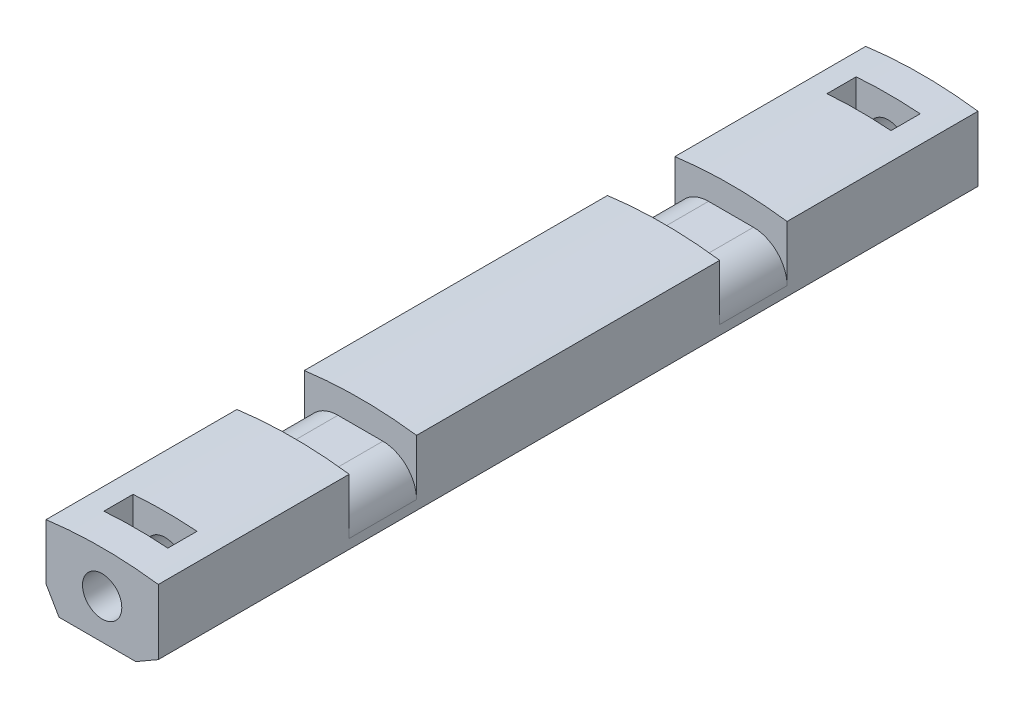
from build123d import *

# Parameters (mm, degrees)
BOSS_EXTRU_2_DEPTH      = 73
ESQUISSE6_W             = 6
ESQUISSE6_H             = 5
ENL_V_MAT_EXTRU_3_DEPTH = 83.675570757
ESQUISSE7_R             = 1.75
ENL_V_MAT_EXTRU_4_DEPTH = 12
ENL_V_START             = -12
ESQUISSE8_R             = 1.75
ENL_V_MAT_EXTRU_5_DEPTH = 12
CONG_1_R                = 3
ENL_V_START_2           = -3
ENL_V_MAT_EXTRU_6_DEPTH = 2.6
ENL_V_START_3           = -5.6
ENL_V_MAT_EXTRU_7_DEPTH = 2.6
CHANFREIN1_SIZE         = 1.154700538
CHANFREIN1_SIZE_2       = 2


with BuildPart() as part:
    # Esquisse3 → Boss.-Extru.2 (new body)
    with BuildSketch(Plane.XY):
        with BuildLine():
            ThreePointArc((-5, 37.165171868), (0, 37.5), (5, 37.165171868))
            Line((5, 37.165171868), (5, 30.214079913))
            Line((5, 30.214079913), (-5, 30.214079913))
            Line((-5, 30.214079913), (-5, 37.165171868))
        make_face()
    extrude(amount=BOSS_EXTRU_2_DEPTH)

    # Esquisse6 → Enlèv. mat.-Extru.3 (cut, through all)
    with BuildSketch(Plane.ZY.offset(5)):
        with Locations((20, 37.714079913)):
            Rectangle(ESQUISSE6_W, ESQUISSE6_H)
        with Locations((53, 37.714079913)):
            Rectangle(ESQUISSE6_W, ESQUISSE6_H)
    extrude(amount=-ENL_V_MAT_EXTRU_3_DEPTH, mode=Mode.SUBTRACT)

    # Esquisse7 → Enlèv. mat.-Extru.4 (cut)
    with BuildSketch(Plane.XY.offset(73)):
        with Locations((0, 33.75)):
            Circle(ESQUISSE7_R)
    extrude(amount=-ENL_V_MAT_EXTRU_4_DEPTH, mode=Mode.SUBTRACT)

    # Esquisse8 → Enlèv. mat.-Extru.5 (cut)
    with BuildSketch(Plane(origin=(0, 0, 0), x_dir=(-1, 0, 0), z_dir=(0, 0, -1)).offset(ENL_V_START)):
        with Locations(Location((0, 33.75, 0), (0, 0, 180))):
            Circle(ESQUISSE8_R)
    extrude(amount=ENL_V_MAT_EXTRU_5_DEPTH, mode=Mode.SUBTRACT)

    # Congé1
    cong_1_edges = [part.edges().sort_by_distance(p)[0] for p in [
        (5, 35.214079913, 20),
        (-5, 35.214079913, 20),
        (5, 35.214079913, 53),
        (-5, 35.214079913, 53),
    ]]
    fillet(cong_1_edges, radius=CONG_1_R)

    # Esquisse9 → Enlèv. mat.-Extru.6 (cut)
    with BuildSketch(Plane(origin=(0, 0, 0), x_dir=(-1, 0, 0), z_dir=(0, 0, -1)).offset(ENL_V_START_2)):
        with BuildLine():
            Line((-2.85, 37.391543162), (-2.85, 31.995448267))
            Line((-2.85, 31.995448267), (0, 30.35))
            Line((0, 30.35), (2.85, 31.995448267))
            Line((2.85, 31.995448267), (2.85, 37.391543162))
            ThreePointArc((2.85, 37.391543162), (0, 37.5), (-2.85, 37.391543162))
        make_face()
    extrude(amount=-ENL_V_MAT_EXTRU_6_DEPTH, mode=Mode.SUBTRACT)

    # Esquisse10 → Enlèv. mat.-Extru.7 (cut)
    with BuildSketch(Plane.XY.offset(73).offset(ENL_V_START_3)):
        with BuildLine():
            Line((-2.85, 37.391543162), (-2.85, 31.995448267))
            Line((-2.85, 31.995448267), (0, 30.35))
            Line((0, 30.35), (2.85, 31.995448267))
            Line((2.85, 31.995448267), (2.85, 37.391543162))
            ThreePointArc((2.85, 37.391543162), (0, 37.5), (-2.85, 37.391543162))
        make_face()
    extrude(amount=ENL_V_MAT_EXTRU_7_DEPTH, mode=Mode.SUBTRACT)

    # Chanfrein1
    # the kernel refuses this chamfer: 2, 1.154700538 mm, written as the material it takes off along each edge
    with BuildSketch(Plane(origin=(5, 30.214079913, -5.174171509), x_dir=(0.0578938624026711, 0.9983227437537925, 0), z_dir=(0, 0, 1)), Plane(origin=(-5, 30.214079913, -5.174171509), x_dir=(0.9983227437537925, -0.05789386240267115, 0), z_dir=(0, 0, 1))) as chanfrein1_piece_1:
        Polygon((CHANFREIN1_SIZE * 0.998322744082, CHANFREIN1_SIZE * 0.0578938624217), (-CHANFREIN1_SIZE_2 * 0.0578938624027, CHANFREIN1_SIZE_2 * 0.998322743754), (0, 0), align=None)
    extrude(amount=83.348343019, mode=Mode.SUBTRACT)


solid = part.part
